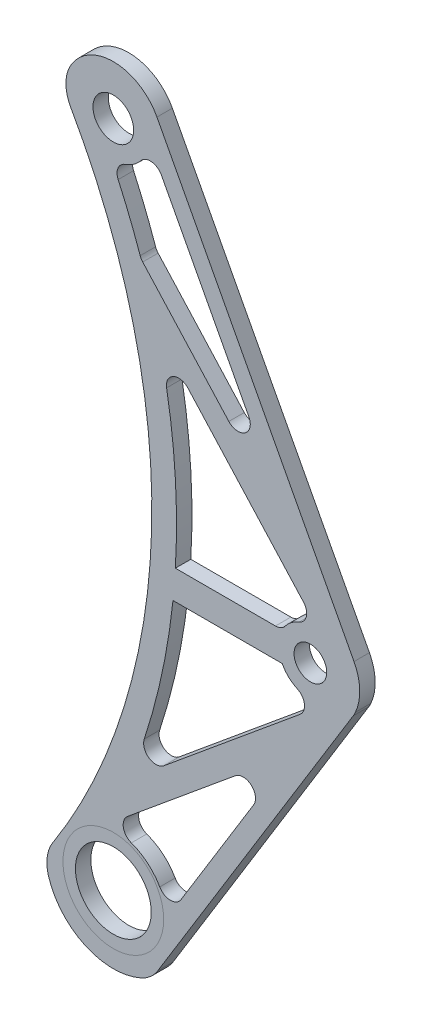
from build123d import *

# Parameters (mm, degrees)
SKETCH1_R           = 7.8105
SKETCH1_R_2         = 3.3655
SKETCH1_R_3         = 4.191
BOSS_EXTRUDE1_DEPTH = 3.175
CUT_EXTRUDE1_DEPTH  = 6.35
FILLET1_R           = 2.54
FILLET5_R           = 7.62


with BuildPart() as part:
    # Sketch1 → Boss-Extrude1 (new body)
    with BuildSketch(Plane.XY):
        with BuildLine():
            Line((8.98309661, 142.414532976), (49.565953559, 65.609056962))
            ThreePointArc((49.565953559, 65.609056962), (50.742856949, 60.862523985), (49.565953559, 56.115991009))
            Line((49.565953559, 56.115991009), (8.177790267, -11.326281223))
            ThreePointArc((8.177790267, -11.326281223), (-6.360706327, -12.437938536), (-13.97, 0))
            ThreePointArc((-13.97, 0), (7.886144716, 68.281846548), (-10.16, 137.668))
            ThreePointArc((-10.16, 137.668), (-2.445131739, 147.529385845), (8.98309661, 142.414532976))
        make_face()
        Circle(SKETCH1_R, mode=Mode.SUBTRACT)
        with Locations((40.582856949, 60.862523985)):
            Circle(SKETCH1_R_2, mode=Mode.SUBTRACT)
        with Locations((0, 137.668)):
            Circle(SKETCH1_R_3, mode=Mode.SUBTRACT)
    extrude(amount=BOSS_EXTRUDE1_DEPTH)

    # Sketch2 → Cut-Extrude1 (cut)
    with BuildSketch(Plane.XY.offset(3.175)):
        with BuildLine():
            ThreePointArc((-1.687172275, 10.855167431), (6.949528794, 8.507952738), (10.973487677, 0.513593659))
            Line((10.973487677, 0.513593659), (36.90141673, 42.763317023))
            Line((36.90141673, 42.763317023), (-1.687172275, 10.855167431))
        make_face()
        with BuildLine():
            ThreePointArc((12.283170574, 57.862523985), (9.009504683, 39.343064628), (3.172468256, 21.465249632))
            Line((3.172468256, 21.465249632), (44.364286203, 55.525958325))
            ThreePointArc((44.364286203, 55.525958325), (39.035089517, 54.507796908), (34.770960507, 57.862523985))
            Line((34.770960507, 57.862523985), (12.283170574, 57.862523985))
        make_face()
        with BuildLine():
            Line((5.700051608, 115.487969959), (37.341521976, 80.589180404))
            Line((37.341521976, 80.589180404), (7.358422957, 137.33398266))
            ThreePointArc((7.358422957, 137.33398266), (4.930965477, 132.195931336), (-0.431201431, 130.314631974))
            ThreePointArc((-0.431201431, 130.314631974), (2.856784408, 122.993252968), (5.700051608, 115.487969959))
        make_face()
        with BuildLine():
            ThreePointArc((34.770960507, 63.862523985), (38.185315424, 66.94774665), (42.786522834, 67.020607852))
            Line((42.786522834, 67.020607852), (9.033823823, 104.247965684))
            ThreePointArc((9.033823823, 104.247965684), (12.444109183, 84.197859008), (12.777235899, 63.862523985))
            Line((12.777235899, 63.862523985), (34.770960507, 63.862523985))
        make_face()
    extrude(amount=-CUT_EXTRUDE1_DEPTH, mode=Mode.SUBTRACT)

    # Fillet1
    fillet1_edges = [part.edges().sort_by_distance(p)[0] for p in [
        (44.364286203, 55.525958325, 1.5875),
        (3.172468256, 21.465249632, 1.5875),
        (42.786522834, 67.020607852, 1.5875),
        (34.770960507, 63.862523985, 1.5875),
        (9.033823823, 104.247965684, 1.5875),
        (-0.431201431, 130.314631974, 1.5875),
        (7.358422957, 137.33398266, 1.5875),
        (37.341521976, 80.589180404, 1.5875),
        (5.700051608, 115.487969959, 1.5875),
        (10.973487677, 0.513593659, 1.5875),
        (-1.687172275, 10.855167431, 1.5875),
        (36.90141673, 42.763317023, 1.5875),
    ]]
    fillet(fillet1_edges, radius=FILLET1_R)

    # Fillet5
    # the kernel refuses this fillet: 7.62 mm, written as the material it takes off along each edge
    with BuildSketch(Plane(origin=(49.565953559, 56.115991009, -1.635210381), x_dir=(0.4384758636480836, 0.8987429649227121, 0), z_dir=(0, 0, 1))) as fillet5_piece_1:
        with BuildLine():
            CenterArc((0.408802595, 7.616051271), FILLET5_R, 264.46995043, 7.374672414)
            Line((-0.325519955, 0.031516322), (0, 0))
            ThreePointArc((0, 0), (0.327042076, -0.005264972), (0.654084152, 0))
        make_face()
    extrude(amount=6.445420761, mode=Mode.SUBTRACT)
    with BuildSketch(Plane(origin=(8.177790267, -11.326281223, -6.821790927), x_dir=(-0.8640520418582298, -0.5034024920087542, 0), z_dir=(0, 0, 1))) as fillet5_piece_2:
        with BuildLine():
            CenterArc((1.984520997, -7.583572591), FILLET5_R, 84.39536353, 33.842547752)
            Line((-1.620758554, -0.870424346), (0, 0))
            ThreePointArc((0, 0), (1.364358185, 0.066783583), (2.728716371, 0))
        make_face()
    extrude(amount=16.818581854, mode=Mode.SUBTRACT)
    with BuildSketch(Plane(origin=(-13.97, 0, -10.324988133), x_dir=(0.5491862360699723, 0.8356999928869789, 0), z_dir=(0, 0, 1))) as fillet5_piece_3:
        with BuildLine():
            CenterArc((2.785592727, -7.619579496), FILLET5_R, 90.601931521, 49.710102388)
            ThreePointArc((-3.078254062, -2.753400211), (-1.641438538, -1.262317601), (0, 0))
            ThreePointArc((0, 0), (1.352770433, -0.007105957), (2.705540865, 0))
        make_face()
    extrude(amount=23.824976265, mode=Mode.SUBTRACT)
    with BuildSketch(Plane(origin=(-10.16, 137.668, -14.214457568), x_dir=(0.2798121568434471, 0.96005476764746, 0), z_dir=(0, 0, 1))) as fillet5_piece_4:
        with BuildLine():
            CenterArc((3.553614392, -7.315617329), FILLET5_R, 73.751006034, 62.011444153)
            ThreePointArc((-1.90576169, -1.999640205), (-0.947518647, -1.004930558), (0, 0))
            ThreePointArc((0, 0), (2.842891514, 0.405843561), (5.685783027, 0))
        make_face()
    extrude(amount=31.603915135, mode=Mode.SUBTRACT)


solid = part.part
